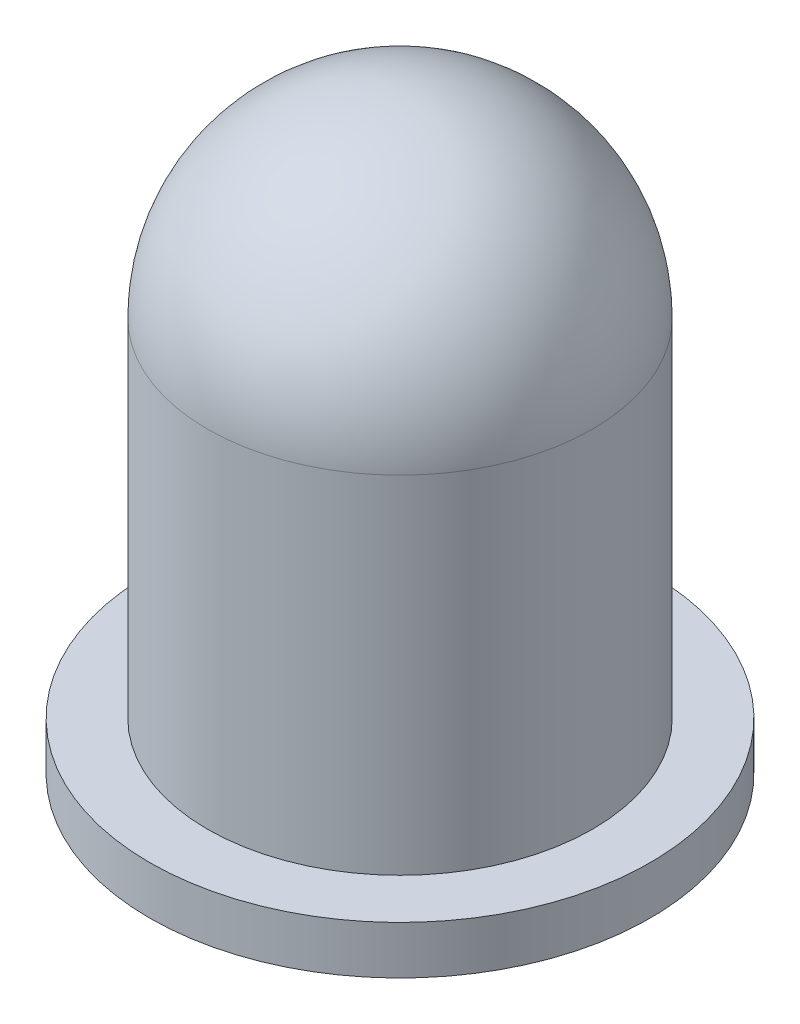
from build123d import *


with BuildPart() as part:
    # Sketch1 → Revolve1 (revolve)
    with BuildSketch(Plane.XY):
        with BuildLine():
            Line((176.926639519, 20.48467433), (176.926639519, 16.88467433))
            Line((176.926639519, 16.88467433), (176.326639519, 16.88467433))
            Line((176.326639519, 16.88467433), (176.326639519, 16.38467433))
            Line((176.326639519, 16.38467433), (178.926639519, 16.38467433))
            Line((178.926639519, 16.38467433), (178.926639519, 22.48467433))
            ThreePointArc((178.926639519, 22.48467433), (177.512425957, 21.898887892), (176.926639519, 20.48467433))
        make_face()
    revolve(axis=Axis((178.926639519, 29.097753813, 0), (0, -1, 0)))


solid = part.part
